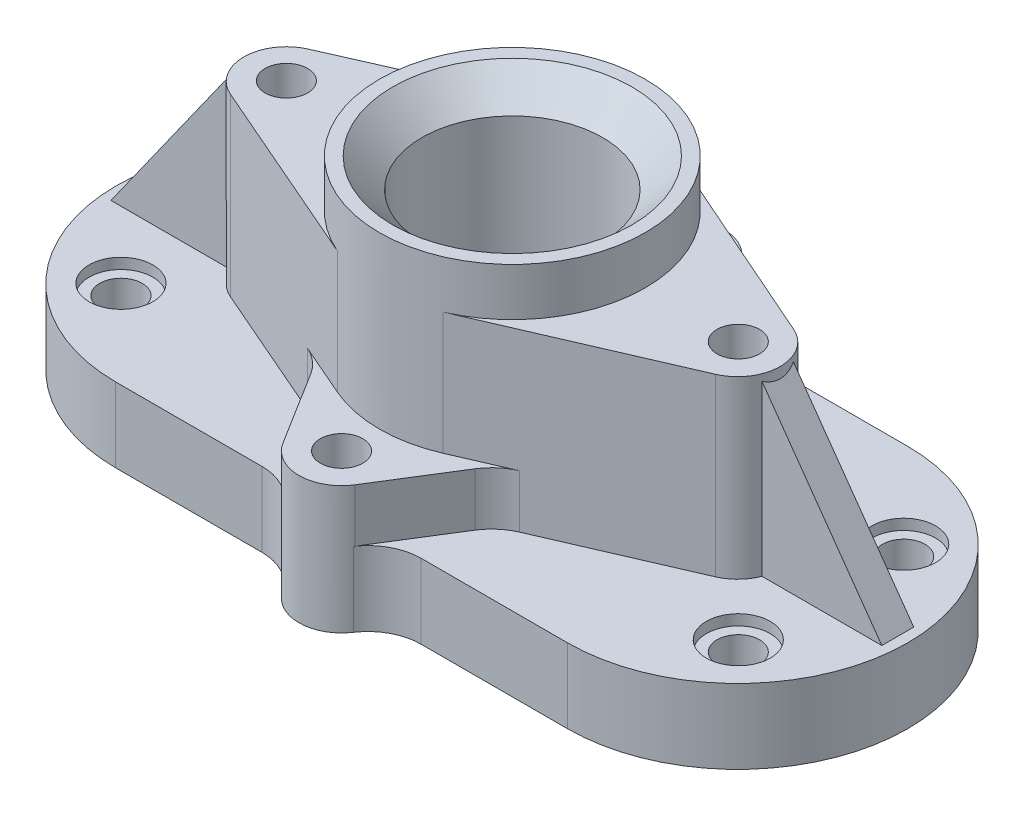
from build123d import *

# Parameters (mm, degrees)
BOSS_EXTRUDE1_DEPTH                       = 14
BOSS_EXTRUDE1_2_DEPTH                     = 14
SKETCH1_3_R                               = 4
BOSS_EXTRUDE2_DEPTH                       = 24
BOSS_EXTRUDE3_DEPTH                       = 47
F_1_6_8_DIAMETER_HOLE1_D                  = 8
F_1_6_8_DIAMETER_HOLE1_DEPTH              = 24
F_1_6_8_DIAMETER_HOLE1_TIP                = 2.309401077
SKETCH1_9_R                               = 25
SKETCH1_9_R_2                             = 22.5
SKETCH1_9_R_3                             = 17
BOSS_EXTRUDE5_DEPTH                       = 56
SKETCH10_R                                = 22.5
CUT_EXTRUDE1_DEPTH                        = 5.5
CUT_EXTRUDE1_DRAFT                        = -45
CUT_EXTRUDE2_DEPTH                        = 102.464355703
CUT_EXTRUDE2_DEPTH_BACK                   = 102.464355703
SKETCH10_3_R                              = 17
RIB1_START                                = -3
RIB1_DEPTH                                = 6
CBORE_FOR_M6_HEX_HEAD_BOLT1_OUTLINE_R     = 4
CBORE_FOR_M6_HEX_HEAD_BOLT1_DEPTH         = 14
CBORE_START                               = 12
CBORE_FOR_M6_HEX_HEAD_BOLT1_2_OUTLINE_R   = 6
CBORE_FOR_M6_HEX_HEAD_BOLT1_2_OUTLINE_R_2 = 4
CBORE_FOR_M6_HEX_HEAD_BOLT1_2_DEPTH       = 2
FILLET1_R                                 = 10


# Read off the part's stored shape, not the designer's step: Rib1, CBORE for M6 Hex Head Bolt1
with BuildPart() as part:
    # Sketch1 → Boss-Extrude1 (new body)
    with BuildSketch(Plane(origin=(0, 0, 0), x_dir=(1, 0, 0), z_dir=(0, 1, 0))):
        with BuildLine():
            ThreePointArc((-42.503892458, 31.883352092), (-74.379375083, -0.116647908), (-42.503892458, -32.116647908))
            Line((-42.503892458, -32.116647908), (-9.432449948, -32.116647908))
            Line((-9.432449948, -32.116647908), (-15.450858564, -22.46743088))
            ThreePointArc((-15.450858564, -22.46743088), (-17.405537185, -20.186185698), (-19.949554848, -18.588430329))
            Line((-19.949554848, -18.588430329), (-45.568063673, -7.453589642))
            ThreePointArc((-45.568063673, -7.453589642), (-50.379101573, -0.138667702), (-45.608404686, 7.202627816))
            Line((-45.608404686, 7.202627816), (-19.874927427, 18.55626737))
            ThreePointArc((-19.874927427, 18.55626737), (-17.377799151, 20.134991341), (-15.450935137, 22.374458705))
            Line((-15.450935137, 22.374458705), (-9.459505287, 31.883352092))
            Line((-9.459505287, 31.883352092), (-42.503892458, 31.883352092))
        make_face()
    extrude(amount=BOSS_EXTRUDE1_DEPTH)



with BuildPart() as body_2:
    # Sketch1 → Boss-Extrude1 2 (new body)
    with BuildSketch(Plane(origin=(0, 0, 0), x_dir=(1, 0, 0), z_dir=(0, 1, 0))):
        with BuildLine():
            Line((15.435705448, -22.486729577), (9.426090996, -32.116647908))
            Line((9.426090996, -32.116647908), (42.496107542, -32.116647908))
            ThreePointArc((42.496107542, -32.116647908), (74.496107542, -0.116647908), (42.496107542, 31.883352092))
            Line((42.496107542, 31.883352092), (9.453175599, 31.883352092))
            Line((9.453175599, 31.883352092), (15.435587635, 22.393908747))
            ThreePointArc((15.435587635, 22.393908747), (17.36666589, 20.151749759), (19.869375819, 18.572894743))
            Line((19.869375819, 18.572894743), (45.716502121, 7.206538472))
            ThreePointArc((45.716502121, 7.206538472), (50.496077404, -0.13860709), (45.676250949, -7.457403176))
            Line((45.676250949, -7.457403176), (19.94410417, -18.605018641))
            ThreePointArc((19.94410417, -18.605018641), (17.39455524, -20.202841451), (15.435705448, -22.486729577))
        make_face()
    extrude(amount=BOSS_EXTRUDE1_2_DEPTH)


with BuildPart() as part_1:
    add(part.part)

    add(body_2.part)  # Boss-Extrude2 merges body 2
    # Sketch1<3> → Boss-Extrude2 (add)
    # profile 1 of 2: a face of its own
    with BuildSketch(Plane(origin=(0, 0, 0), x_dir=(1, 0, 0), z_dir=(0, 1, 0))):
        with BuildLine():
            Line((-15.450858564, -22.46743088), (-6.791781281, -36.350389201))
            ThreePointArc((-6.791781281, -36.350389201), (-0.004862038, -40.116647849), (6.782969927, -36.352034427))
            Line((6.782969927, -36.352034427), (15.435705448, -22.486729577))
            ThreePointArc((15.435705448, -22.486729577), (17.39455524, -20.202841451), (19.94410417, -18.605018641))
            Line((19.94410417, -18.605018641), (9.937948149, -22.939860213))
            ThreePointArc((9.937948149, -22.939860213), (-0.014968945, -24.999995519), (-9.96541186, -22.927942918))
            Line((-9.96541186, -22.927942918), (-19.949554848, -18.588430329))
            ThreePointArc((-19.949554848, -18.588430329), (-17.405537185, -20.186185698), (-15.450858564, -22.46743088))
        make_face()
        with Locations(Location((-0.003892458, -32.116647908, 0), (0, 0, 270))):
            Circle(SKETCH1_3_R, mode=Mode.SUBTRACT)
    # profile 2 of 2: a face of its own
    with BuildSketch(Plane(origin=(0, 0, 0), x_dir=(1, 0, 0), z_dir=(0, 1, 0))):
        with BuildLine():
            Line((-6.772359099, 36.148074748), (-15.450935137, 22.374458705))
            ThreePointArc((-15.450935137, 22.374458705), (-17.377799151, 20.134991341), (-19.874927427, 18.55626737))
            Line((-19.874927427, 18.55626737), (-10.091477525, 22.872736639))
            ThreePointArc((-10.091477525, 22.872736639), (-0.015158358, 24.999995404), (10.063733061, 22.884957437))
            Line((10.063733061, 22.884957437), (19.869375819, 18.572894743))
            ThreePointArc((19.869375819, 18.572894743), (17.36666589, 20.151749759), (15.435587635, 22.393908747))
            Line((15.435587635, 22.393908747), (6.763532669, 36.149727269))
            ThreePointArc((6.763532669, 36.149727269), (-0.004869133, 39.883352032), (-6.772359099, 36.148074748))
        make_face()
        with Locations(Location((-0.003892458, 31.883352092, 0), (0, 0, 270))):
            Circle(SKETCH1_3_R, mode=Mode.SUBTRACT)
    extrude(amount=BOSS_EXTRUDE2_DEPTH)

    # Sketch1<4> → Boss-Extrude3 (add)
    with BuildSketch(Plane(origin=(0, 0, 0), x_dir=(1, 0, 0), z_dir=(0, 1, 0))):
        with BuildLine():
            Line((-45.568063673, -7.453589642), (-9.96541186, -22.927942918))
            ThreePointArc((-9.96541186, -22.927942918), (-0.014968945, -24.999995519), (9.937948149, -22.939860213))
            Line((9.937948149, -22.939860213), (45.676250949, -7.457403176))
            ThreePointArc((45.676250949, -7.457403176), (50.496077404, -0.13860709), (45.716502121, 7.206538472))
            Line((45.716502121, 7.206538472), (10.063733061, 22.884957437))
            ThreePointArc((10.063733061, 22.884957437), (-0.015158358, 24.999995404), (-10.091477525, 22.872736639))
            Line((-10.091477525, 22.872736639), (-45.608404686, 7.202627816))
            ThreePointArc((-45.608404686, 7.202627816), (-50.379101573, -0.138667702), (-45.568063673, -7.453589642))
        make_face()
    extrude(amount=BOSS_EXTRUDE3_DEPTH)

    # Ø1.6 (8) Diameter Hole1
    with Locations(Plane(origin=(0, 47, 0), x_dir=(1, 0, 0), z_dir=(0, 1, 0))):
        with Locations((-42.5, 0), (42.5, 0)):
            Hole(F_1_6_8_DIAMETER_HOLE1_D / 2, depth=F_1_6_8_DIAMETER_HOLE1_DEPTH)
            with Locations((0, 0, -(F_1_6_8_DIAMETER_HOLE1_DEPTH + F_1_6_8_DIAMETER_HOLE1_TIP / 2))):  # 120° drill point
                Cone(0, F_1_6_8_DIAMETER_HOLE1_D / 2, F_1_6_8_DIAMETER_HOLE1_TIP, mode=Mode.SUBTRACT)

    # Sketch1<9> → Boss-Extrude5 (add)
    # profile 1 of 3: a face of its own
    with BuildSketch(Plane(origin=(0, 0, 0), x_dir=(1, 0, 0), z_dir=(0, 1, 0))):
        with Locations(Location((0, 0, 0), (0, 0, 66.262354029))):
            Circle(SKETCH1_9_R)
        Circle(SKETCH1_9_R_2, mode=Mode.SUBTRACT)
    # profile 2 of 3: a face of its own
    with BuildSketch(Plane(origin=(0, 0, 0), x_dir=(1, 0, 0), z_dir=(0, 1, 0))):
        Circle(SKETCH1_9_R_2)
        Circle(SKETCH1_9_R_3, mode=Mode.SUBTRACT)
    # profile 3 of 3: a face of its own
    with BuildSketch(Plane(origin=(0, 0, 0), x_dir=(1, 0, 0), z_dir=(0, 1, 0))):
        Circle(SKETCH1_9_R_3)
    extrude(amount=BOSS_EXTRUDE5_DEPTH)


with BuildPart() as cut_extrude1_tool:
    # Sketch10 → Cut-Extrude1 (with draft: the straight prism first)
    with BuildSketch(Plane(origin=(0, 56, 0), x_dir=(1, 0, 0), z_dir=(0, 1, 0))):
        Circle(SKETCH10_R)
    extrude(amount=-CUT_EXTRUDE1_DEPTH)
    # Cut-Extrude1: the draft: its side faces are tilted about the plane it starts from
    cut_extrude1_sides = [cut_extrude1_tool.faces().sort_by_distance(p)[0] for p in [
        (-22.5, 53.25, 0),
    ]]
    draft(cut_extrude1_sides, Plane(origin=(0, 56, 0), x_dir=(1, 0, 0), z_dir=(0, 1, 0)), CUT_EXTRUDE1_DRAFT)


with BuildPart() as part_2:
    add(part_1.part)

    # Cut-Extrude1: cut by cut_extrude1_tool
    add(cut_extrude1_tool.part, mode=Mode.SUBTRACT)

    # Sketch10<3> → Cut-Extrude2 (cut, two sides: drawn at the far end of the back side and taken through both)
    with BuildSketch(Plane(origin=(0, 56, 0), x_dir=(1, 0, 0), z_dir=(0, 1, 0)).offset(-CUT_EXTRUDE2_DEPTH_BACK)):
        with Locations(Location((0, 0, 0), (0, 0, 270))):
            Circle(SKETCH10_3_R)
    extrude(amount=CUT_EXTRUDE2_DEPTH + CUT_EXTRUDE2_DEPTH_BACK, mode=Mode.SUBTRACT)

    # Rib1 outline → Rib1 (add)
    with BuildSketch(Plane.XY.offset(RIB1_START)):
        Polygon((72.496107542, 14), (49.864045233, 45.890633254), (49.076752704, 47), (48, 47), (48, 14), align=None)
    rib1 = extrude(amount=RIB1_DEPTH)

    # Mirror1: Rib1 across plane
    add(rib1.mirror(Plane(origin=(0, 0, 0), x_dir=(0, 0, 1), z_dir=(1, 0, 0))))

    # CBORE for M6 Hex Head Bolt1 outline → CBORE for M6 Hex Head Bolt1 (cut)
    with BuildSketch(Plane(origin=(0, 0, 0), x_dir=(1, 0, 0), z_dir=(0, 1, 0))):
        with Locations((-42.5, 0)):
            Circle(CBORE_FOR_M6_HEX_HEAD_BOLT1_OUTLINE_R)
        with Locations((-58.056349186, 15.556349186)):
            Circle(CBORE_FOR_M6_HEX_HEAD_BOLT1_OUTLINE_R)
        with Locations((-58.056349186, -15.556349186)):
            Circle(CBORE_FOR_M6_HEX_HEAD_BOLT1_OUTLINE_R)
    cbore_for_m6_hex_head_bolt1 = extrude(amount=CBORE_FOR_M6_HEX_HEAD_BOLT1_DEPTH, mode=Mode.SUBTRACT)

    # CBORE for M6 Hex Head Bolt1 2 outline → CBORE for M6 Hex Head Bolt1 2 (cut)
    # profile 1 of 3: a face of its own
    with BuildSketch(Plane(origin=(0, 0, 0), x_dir=(1, 0, 0), z_dir=(0, 1, 0)).offset(CBORE_START)):
        with Locations((-42.5, 0)):
            Circle(CBORE_FOR_M6_HEX_HEAD_BOLT1_2_OUTLINE_R)
        with Locations((-42.5, 0)):
            Circle(CBORE_FOR_M6_HEX_HEAD_BOLT1_2_OUTLINE_R_2, mode=Mode.SUBTRACT)
    # profile 2 of 3: a face of its own
    with BuildSketch(Plane(origin=(0, 0, 0), x_dir=(1, 0, 0), z_dir=(0, 1, 0)).offset(CBORE_START)):
        with Locations((-58.056349186, 15.556349186)):
            Circle(CBORE_FOR_M6_HEX_HEAD_BOLT1_2_OUTLINE_R)
        with Locations((-58.056349186, 15.556349186)):
            Circle(CBORE_FOR_M6_HEX_HEAD_BOLT1_2_OUTLINE_R_2, mode=Mode.SUBTRACT)
    # profile 3 of 3: a face of its own
    with BuildSketch(Plane(origin=(0, 0, 0), x_dir=(1, 0, 0), z_dir=(0, 1, 0)).offset(CBORE_START)):
        with Locations((-58.056349186, -15.556349186)):
            Circle(CBORE_FOR_M6_HEX_HEAD_BOLT1_2_OUTLINE_R)
        with Locations((-58.056349186, -15.556349186)):
            Circle(CBORE_FOR_M6_HEX_HEAD_BOLT1_2_OUTLINE_R_2, mode=Mode.SUBTRACT)
    cbore_for_m6_hex_head_bolt1_2 = extrude(amount=CBORE_FOR_M6_HEX_HEAD_BOLT1_2_DEPTH, mode=Mode.SUBTRACT)

    # Mirror2: CBORE for M6 Hex Head Bolt1, CBORE for M6 Hex Head Bolt1 2 across plane
    add(cbore_for_m6_hex_head_bolt1.mirror(Plane(origin=(0, 0, 0), x_dir=(0, 0, 1), z_dir=(1, 0, 0))), mode=Mode.SUBTRACT)
    add(cbore_for_m6_hex_head_bolt1_2.mirror(Plane(origin=(0, 0, 0), x_dir=(0, 0, 1), z_dir=(1, 0, 0))), mode=Mode.SUBTRACT)

    # Fillet1
    # the kernel refuses this fillet: 10 mm, written as the material it adds along each edge
    with BuildSketch(Plane(origin=(-9.459505287, 0, -31.883352092), x_dir=(-1, 0, 0), z_dir=(0, 1, 0))) as fillet1_piece_1:
        with BuildLine():
            CenterArc((5.511016718, -10), FILLET1_R, 90, 56.251011404)
            Line((-2.803777475, -4.444444444), (-3.635256894, -3.888888889))
            ThreePointArc((-3.635256894, -3.888888889), (-3.533204519, -3.731632324), (-0.84605833, 0.533090332))
            Line((-0.84605833, 0.533090332), (0, 1))
            Line((0, 1), (5.511016718, 1))
            Line((5.511016718, 1), (5.511016718, 0))
        make_face()
    extrude(amount=14)
    with BuildSketch(Plane(origin=(9.453175599, 0, -31.883352092), x_dir=(-0.5337502052865287, 0, -0.8456421928668107), z_dir=(0, 1, 0))) as fillet1_piece_2:
        with BuildLine():
            CenterArc((5.515692353, -9.996619713), FILLET1_R, 91.489795541, 56.251011404)
            Line((-2.940729576, -4.65911766), (-3.786371769, -4.125367455))
            Line((-3.786371769, -4.125367455), (-0.845642193, 0.533750205))
            Line((-0.845642193, 0.533750205), (0.000535961, 0.999999856))
            ThreePointArc((0.000535961, 0.999999856), (5.043960288, 0.997296776), (5.22970437, 0.999661971))
            Line((5.22970437, 0.999661971), (5.255703277, 0))
        make_face()
    extrude(amount=14)
    with BuildSketch(Plane(origin=(-9.432449948, 0, 32.116647908), x_dir=(-1, 0, 0), z_dir=(0, 1, 0))) as fillet1_piece_3:
        with BuildLine():
            CenterArc((5.538072057, 10), FILLET1_R, 213.748988596, 56.251011404)
            Line((-2.776722136, 4.444444444), (-3.608201555, 3.888888889))
            ThreePointArc((-3.608201555, 3.888888889), (-3.48915477, 3.704523631), (-0.848486103, -0.529217662))
            Line((-0.848486103, -0.529217662), (0, -1))
            Line((0, -1), (5.538072057, -1))
            Line((5.538072057, -1), (5.538072057, 0))
        make_face()
    extrude(amount=14)
    with BuildSketch(Plane(origin=(9.426090996, 0, 32.116647908), x_dir=(-0.5300497469309569, 0, 0.8479665475585866), z_dir=(0, 1, 0))) as fillet1_piece_4:
        with BuildLine():
            CenterArc((5.544967615, 9.995388142), FILLET1_R, 212.008816089, 56.251011404)
            Line((-2.93469786, 4.694890672), (-3.782664408, 4.164840925))
            Line((-3.782664408, 4.164840925), (-0.847966548, -0.530049747))
            Line((-0.847966548, -0.530049747), (0.000738576, -0.999999727))
            ThreePointArc((0.000738576, -0.999999727), (4.993190313, -0.996312423), (5.210929838, -0.999538814))
            Line((5.210929838, -0.999538814), (5.241296909, 0))
        make_face()
    extrude(amount=14)


solid = part_2.part
